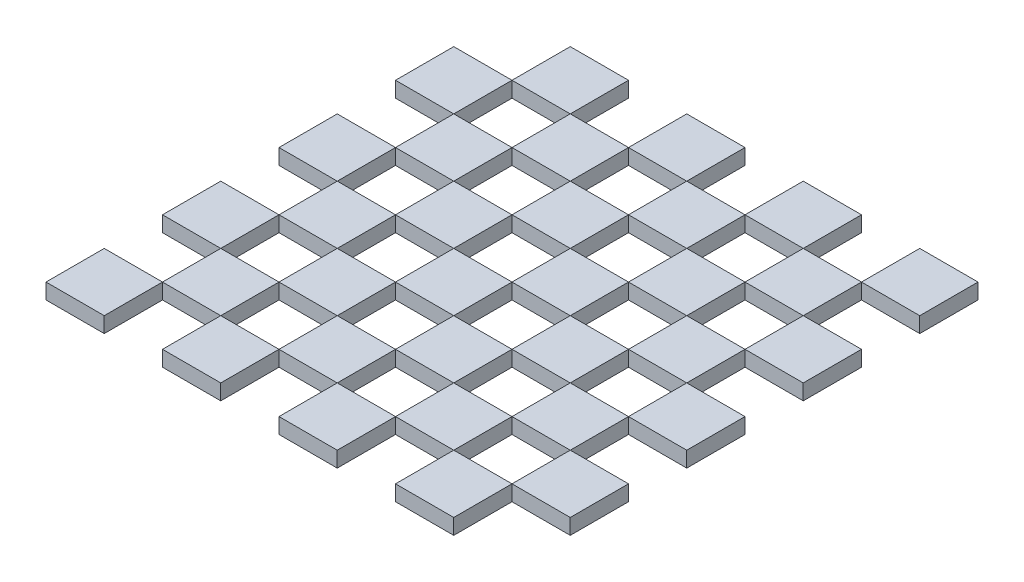
from build123d import *

# Parameters (mm, degrees)
SKETCH1_W              = 37.5
SKETCH1_H              = 37.5
BOSS_EXTRUDE1_DEPTH    = 10
BOSS_EXTRUDE1_2_DEPTH  = 10
BOSS_EXTRUDE1_3_DEPTH  = 10
BOSS_EXTRUDE1_4_DEPTH  = 10
BOSS_EXTRUDE1_5_DEPTH  = 10
BOSS_EXTRUDE1_6_DEPTH  = 10
BOSS_EXTRUDE1_7_DEPTH  = 10
BOSS_EXTRUDE1_8_DEPTH  = 10
BOSS_EXTRUDE1_9_DEPTH  = 10
BOSS_EXTRUDE1_10_DEPTH = 10
BOSS_EXTRUDE1_11_DEPTH = 10
BOSS_EXTRUDE1_12_DEPTH = 10
BOSS_EXTRUDE1_13_DEPTH = 10
BOSS_EXTRUDE1_14_DEPTH = 10
BOSS_EXTRUDE1_15_DEPTH = 10
BOSS_EXTRUDE1_16_DEPTH = 10
BOSS_EXTRUDE1_17_DEPTH = 10
BOSS_EXTRUDE1_18_DEPTH = 10
BOSS_EXTRUDE1_19_DEPTH = 10
BOSS_EXTRUDE1_20_DEPTH = 10
BOSS_EXTRUDE1_21_DEPTH = 10
BOSS_EXTRUDE1_22_DEPTH = 10
BOSS_EXTRUDE1_23_DEPTH = 10
BOSS_EXTRUDE1_24_DEPTH = 10
BOSS_EXTRUDE1_25_DEPTH = 10
BOSS_EXTRUDE1_26_DEPTH = 10
BOSS_EXTRUDE1_27_DEPTH = 10
BOSS_EXTRUDE1_28_DEPTH = 10
BOSS_EXTRUDE1_29_DEPTH = 10
BOSS_EXTRUDE1_30_DEPTH = 10
BOSS_EXTRUDE1_31_DEPTH = 10
BOSS_EXTRUDE1_32_DEPTH = 10


with BuildPart() as part:
    # Sketch1 → Boss-Extrude1 (new body)
    with BuildSketch(Plane(origin=(0, 0, 0), x_dir=(1, 0, 0), z_dir=(0, 1, 0))):
        with Locations((-18.75, 131.25)):
            Rectangle(SKETCH1_W, SKETCH1_H)
    extrude(amount=BOSS_EXTRUDE1_DEPTH)


with BuildPart() as body_2:
    # Sketch1 → Boss-Extrude1 2 (new body)
    with BuildSketch(Plane(origin=(0, 0, 0), x_dir=(1, 0, 0), z_dir=(0, 1, 0))):
        with Locations((18.75, 93.75)):
            Rectangle(SKETCH1_W, SKETCH1_H)
    extrude(amount=BOSS_EXTRUDE1_2_DEPTH)


with BuildPart() as body_3:
    # Sketch1 → Boss-Extrude1 3 (new body)
    with BuildSketch(Plane(origin=(0, 0, 0), x_dir=(1, 0, 0), z_dir=(0, 1, 0))):
        with Locations((56.25, 131.25)):
            Rectangle(SKETCH1_W, SKETCH1_H)
    extrude(amount=BOSS_EXTRUDE1_3_DEPTH)


with BuildPart() as body_4:
    # Sketch1 → Boss-Extrude1 4 (new body)
    with BuildSketch(Plane(origin=(0, 0, 0), x_dir=(1, 0, 0), z_dir=(0, 1, 0))):
        with Locations((-18.75, 56.25)):
            Rectangle(SKETCH1_W, SKETCH1_H)
    extrude(amount=BOSS_EXTRUDE1_4_DEPTH)


with BuildPart() as body_5:
    # Sketch1 → Boss-Extrude1 5 (new body)
    with BuildSketch(Plane(origin=(0, 0, 0), x_dir=(1, 0, 0), z_dir=(0, 1, 0))):
        with Locations((-56.25, 93.75)):
            Rectangle(SKETCH1_W, SKETCH1_H)
    extrude(amount=BOSS_EXTRUDE1_5_DEPTH)


with BuildPart() as body_6:
    # Sketch1 → Boss-Extrude1 6 (new body)
    with BuildSketch(Plane(origin=(0, 0, 0), x_dir=(1, 0, 0), z_dir=(0, 1, 0))):
        with Locations((-93.75, 131.25)):
            Rectangle(SKETCH1_W, SKETCH1_H)
    extrude(amount=BOSS_EXTRUDE1_6_DEPTH)


with BuildPart() as body_7:
    # Sketch1 → Boss-Extrude1 7 (new body)
    with BuildSketch(Plane(origin=(0, 0, 0), x_dir=(1, 0, 0), z_dir=(0, 1, 0))):
        with Locations((18.75, 18.75)):
            Rectangle(SKETCH1_W, SKETCH1_H)
    extrude(amount=BOSS_EXTRUDE1_7_DEPTH)


with BuildPart() as body_8:
    # Sketch1 → Boss-Extrude1 8 (new body)
    with BuildSketch(Plane(origin=(0, 0, 0), x_dir=(1, 0, 0), z_dir=(0, 1, 0))):
        with Locations((56.25, 56.25)):
            Rectangle(SKETCH1_W, SKETCH1_H)
    extrude(amount=BOSS_EXTRUDE1_8_DEPTH)


with BuildPart() as body_9:
    # Sketch1 → Boss-Extrude1 9 (new body)
    with BuildSketch(Plane(origin=(0, 0, 0), x_dir=(1, 0, 0), z_dir=(0, 1, 0))):
        with Locations((93.75, 93.75)):
            Rectangle(SKETCH1_W, SKETCH1_H)
    extrude(amount=BOSS_EXTRUDE1_9_DEPTH)


with BuildPart() as body_10:
    # Sketch1 → Boss-Extrude1 10 (new body)
    with BuildSketch(Plane(origin=(0, 0, 0), x_dir=(1, 0, 0), z_dir=(0, 1, 0))):
        with Locations((131.25, 131.25)):
            Rectangle(SKETCH1_W, SKETCH1_H)
    extrude(amount=BOSS_EXTRUDE1_10_DEPTH)


with BuildPart() as body_11:
    # Sketch1 → Boss-Extrude1 11 (new body)
    with BuildSketch(Plane(origin=(0, 0, 0), x_dir=(1, 0, 0), z_dir=(0, 1, 0))):
        with Locations((-18.75, -18.75)):
            Rectangle(SKETCH1_W, SKETCH1_H)
    extrude(amount=BOSS_EXTRUDE1_11_DEPTH)


with BuildPart() as body_12:
    # Sketch1 → Boss-Extrude1 12 (new body)
    with BuildSketch(Plane(origin=(0, 0, 0), x_dir=(1, 0, 0), z_dir=(0, 1, 0))):
        with Locations((-56.25, 18.75)):
            Rectangle(SKETCH1_W, SKETCH1_H)
    extrude(amount=BOSS_EXTRUDE1_12_DEPTH)


with BuildPart() as body_13:
    # Sketch1 → Boss-Extrude1 13 (new body)
    with BuildSketch(Plane(origin=(0, 0, 0), x_dir=(1, 0, 0), z_dir=(0, 1, 0))):
        with Locations((-93.75, 56.25)):
            Rectangle(SKETCH1_W, SKETCH1_H)
    extrude(amount=BOSS_EXTRUDE1_13_DEPTH)


with BuildPart() as body_14:
    # Sketch1 → Boss-Extrude1 14 (new body)
    with BuildSketch(Plane(origin=(0, 0, 0), x_dir=(1, 0, 0), z_dir=(0, 1, 0))):
        with Locations((-131.25, 93.75)):
            Rectangle(SKETCH1_W, SKETCH1_H)
    extrude(amount=BOSS_EXTRUDE1_14_DEPTH)


with BuildPart() as body_15:
    # Sketch1 → Boss-Extrude1 15 (new body)
    with BuildSketch(Plane(origin=(0, 0, 0), x_dir=(1, 0, 0), z_dir=(0, 1, 0))):
        with Locations((18.75, -56.25)):
            Rectangle(SKETCH1_W, SKETCH1_H)
    extrude(amount=BOSS_EXTRUDE1_15_DEPTH)


with BuildPart() as body_16:
    # Sketch1 → Boss-Extrude1 16 (new body)
    with BuildSketch(Plane(origin=(0, 0, 0), x_dir=(1, 0, 0), z_dir=(0, 1, 0))):
        with Locations((56.25, -18.75)):
            Rectangle(SKETCH1_W, SKETCH1_H)
    extrude(amount=BOSS_EXTRUDE1_16_DEPTH)


with BuildPart() as body_17:
    # Sketch1 → Boss-Extrude1 17 (new body)
    with BuildSketch(Plane(origin=(0, 0, 0), x_dir=(1, 0, 0), z_dir=(0, 1, 0))):
        with Locations((93.75, 18.75)):
            Rectangle(SKETCH1_W, SKETCH1_H)
    extrude(amount=BOSS_EXTRUDE1_17_DEPTH)


with BuildPart() as body_18:
    # Sketch1 → Boss-Extrude1 18 (new body)
    with BuildSketch(Plane(origin=(0, 0, 0), x_dir=(1, 0, 0), z_dir=(0, 1, 0))):
        with Locations((131.25, 56.25)):
            Rectangle(SKETCH1_W, SKETCH1_H)
    extrude(amount=BOSS_EXTRUDE1_18_DEPTH)


with BuildPart() as body_19:
    # Sketch1 → Boss-Extrude1 19 (new body)
    with BuildSketch(Plane(origin=(0, 0, 0), x_dir=(1, 0, 0), z_dir=(0, 1, 0))):
        with Locations((-18.75, -93.75)):
            Rectangle(SKETCH1_W, SKETCH1_H)
    extrude(amount=BOSS_EXTRUDE1_19_DEPTH)


with BuildPart() as body_20:
    # Sketch1 → Boss-Extrude1 20 (new body)
    with BuildSketch(Plane(origin=(0, 0, 0), x_dir=(1, 0, 0), z_dir=(0, 1, 0))):
        with Locations((-56.25, -56.25)):
            Rectangle(SKETCH1_W, SKETCH1_H)
    extrude(amount=BOSS_EXTRUDE1_20_DEPTH)


with BuildPart() as body_21:
    # Sketch1 → Boss-Extrude1 21 (new body)
    with BuildSketch(Plane(origin=(0, 0, 0), x_dir=(1, 0, 0), z_dir=(0, 1, 0))):
        with Locations((-93.75, -18.75)):
            Rectangle(SKETCH1_W, SKETCH1_H)
    extrude(amount=BOSS_EXTRUDE1_21_DEPTH)


with BuildPart() as body_22:
    # Sketch1 → Boss-Extrude1 22 (new body)
    with BuildSketch(Plane(origin=(0, 0, 0), x_dir=(1, 0, 0), z_dir=(0, 1, 0))):
        with Locations((-131.25, 18.75)):
            Rectangle(SKETCH1_W, SKETCH1_H)
    extrude(amount=BOSS_EXTRUDE1_22_DEPTH)


with BuildPart() as body_23:
    # Sketch1 → Boss-Extrude1 23 (new body)
    with BuildSketch(Plane(origin=(0, 0, 0), x_dir=(1, 0, 0), z_dir=(0, 1, 0))):
        with Locations((18.75, -131.25)):
            Rectangle(SKETCH1_W, SKETCH1_H)
    extrude(amount=BOSS_EXTRUDE1_23_DEPTH)


with BuildPart() as body_24:
    # Sketch1 → Boss-Extrude1 24 (new body)
    with BuildSketch(Plane(origin=(0, 0, 0), x_dir=(1, 0, 0), z_dir=(0, 1, 0))):
        with Locations((56.25, -93.75)):
            Rectangle(SKETCH1_W, SKETCH1_H)
    extrude(amount=BOSS_EXTRUDE1_24_DEPTH)


with BuildPart() as body_25:
    # Sketch1 → Boss-Extrude1 25 (new body)
    with BuildSketch(Plane(origin=(0, 0, 0), x_dir=(1, 0, 0), z_dir=(0, 1, 0))):
        with Locations((93.75, -56.25)):
            Rectangle(SKETCH1_W, SKETCH1_H)
    extrude(amount=BOSS_EXTRUDE1_25_DEPTH)


with BuildPart() as body_26:
    # Sketch1 → Boss-Extrude1 26 (new body)
    with BuildSketch(Plane(origin=(0, 0, 0), x_dir=(1, 0, 0), z_dir=(0, 1, 0))):
        with Locations((131.25, -18.75)):
            Rectangle(SKETCH1_W, SKETCH1_H)
    extrude(amount=BOSS_EXTRUDE1_26_DEPTH)


with BuildPart() as body_27:
    # Sketch1 → Boss-Extrude1 27 (new body)
    with BuildSketch(Plane(origin=(0, 0, 0), x_dir=(1, 0, 0), z_dir=(0, 1, 0))):
        with Locations((-56.25, -131.25)):
            Rectangle(SKETCH1_W, SKETCH1_H)
    extrude(amount=BOSS_EXTRUDE1_27_DEPTH)


with BuildPart() as body_28:
    # Sketch1 → Boss-Extrude1 28 (new body)
    with BuildSketch(Plane(origin=(0, 0, 0), x_dir=(1, 0, 0), z_dir=(0, 1, 0))):
        with Locations((-93.75, -93.75)):
            Rectangle(SKETCH1_W, SKETCH1_H)
    extrude(amount=BOSS_EXTRUDE1_28_DEPTH)


with BuildPart() as body_29:
    # Sketch1 → Boss-Extrude1 29 (new body)
    with BuildSketch(Plane(origin=(0, 0, 0), x_dir=(1, 0, 0), z_dir=(0, 1, 0))):
        with Locations((-131.25, -56.25)):
            Rectangle(SKETCH1_W, SKETCH1_H)
    extrude(amount=BOSS_EXTRUDE1_29_DEPTH)


with BuildPart() as body_30:
    # Sketch1 → Boss-Extrude1 30 (new body)
    with BuildSketch(Plane(origin=(0, 0, 0), x_dir=(1, 0, 0), z_dir=(0, 1, 0))):
        with Locations((93.75, -131.25)):
            Rectangle(SKETCH1_W, SKETCH1_H)
    extrude(amount=BOSS_EXTRUDE1_30_DEPTH)


with BuildPart() as body_31:
    # Sketch1 → Boss-Extrude1 31 (new body)
    with BuildSketch(Plane(origin=(0, 0, 0), x_dir=(1, 0, 0), z_dir=(0, 1, 0))):
        with Locations((131.25, -93.75)):
            Rectangle(SKETCH1_W, SKETCH1_H)
    extrude(amount=BOSS_EXTRUDE1_31_DEPTH)


with BuildPart() as body_32:
    # Sketch1 → Boss-Extrude1 32 (new body)
    with BuildSketch(Plane(origin=(0, 0, 0), x_dir=(1, 0, 0), z_dir=(0, 1, 0))):
        with Locations((-131.25, -131.25)):
            Rectangle(SKETCH1_W, SKETCH1_H)
    extrude(amount=BOSS_EXTRUDE1_32_DEPTH)


solid = Compound([part.part, body_2.part, body_3.part, body_4.part, body_5.part, body_6.part, body_7.part, body_8.part, body_9.part, body_10.part, body_11.part, body_12.part, body_13.part, body_14.part, body_15.part, body_16.part, body_17.part, body_18.part, body_19.part, body_20.part, body_21.part, body_22.part, body_23.part, body_24.part, body_25.part, body_26.part, body_27.part, body_28.part, body_29.part, body_30.part, body_31.part, body_32.part])
